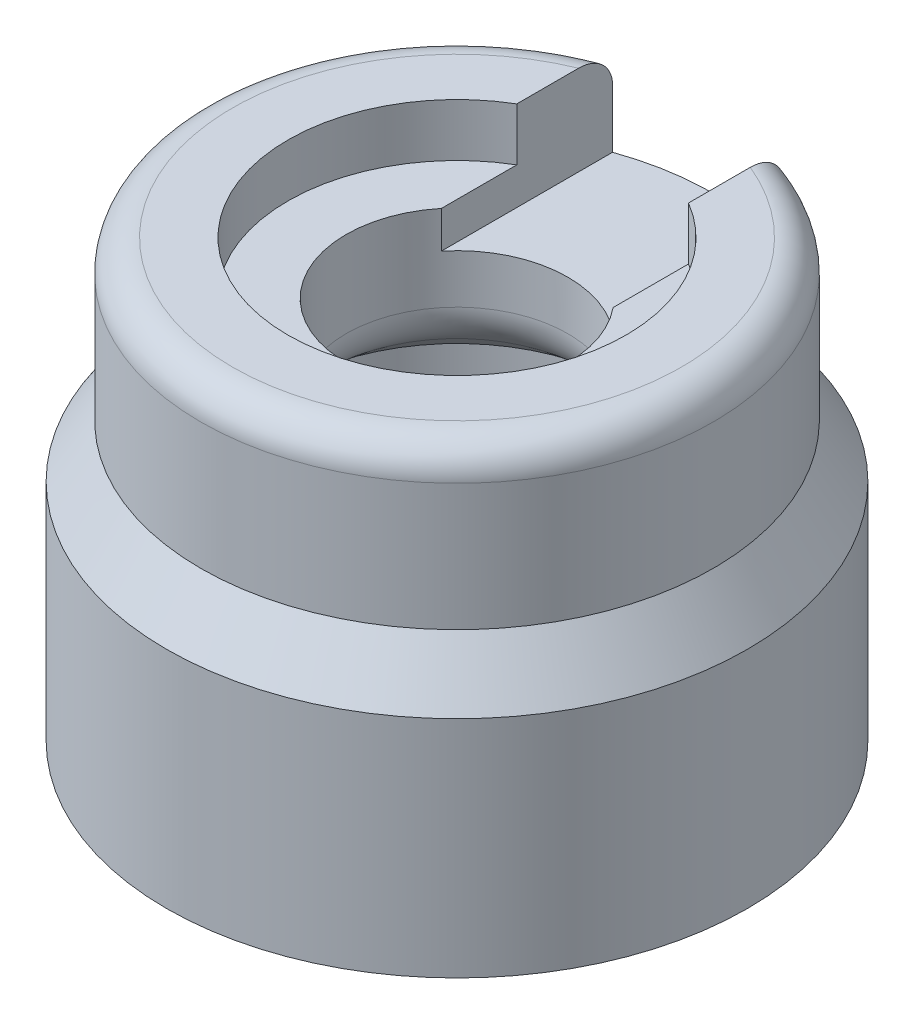
from build123d import *

# Parameters (mm, degrees)
CROQUIS1_R              = 5.5
CROQUIS1_R_2            = 3.2
SALIENTE_EXTRUIR1_DEPTH = 4.25
CROQUIS3_R              = 4.85
CROQUIS3_R_2            = 2.1
SALIENTE_EXTRUIR2_DEPTH = 3
REDONDEO1_R             = 0.6
CORTAR_EXTRUIR1_START   = -1
CROQUIS4_R              = 3.2
CORTAR_EXTRUIR1_DEPTH   = 1
CORTAR_EXTRUIR2_START   = -0.7
CROQUIS5_W              = 3.25
CROQUIS5_H              = 5
CORTAR_EXTRUIR2_DEPTH   = 12.333085159
REDONDEO2_R             = 1
REDONDEO3_R             = 0.75


with BuildPart() as part:
    # Croquis1 → Saliente-Extruir1 (new body)
    with BuildSketch(Plane(origin=(0, 0, 0), x_dir=(1, 0, 0), z_dir=(0, 1, 0))):
        Circle(CROQUIS1_R)
        Circle(CROQUIS1_R_2, mode=Mode.SUBTRACT)
    extrude(amount=SALIENTE_EXTRUIR1_DEPTH)

    # Croquis2 → Revolución1 (revolve)
    with BuildSketch(Plane.XY):
        Polygon((-5.5, 4.25), (-4.85, 5.25), (-2.1, 5.25), (-2.1, 5.15), (-3.2, 4.25), align=None)
    revolve(axis=Axis((0, 0, 0), (0, 1, 0)))

    # Croquis3 → Saliente-Extruir2 (add)
    with BuildSketch(Plane(origin=(0, 5.25, 0), x_dir=(1, 0, 0), z_dir=(0, 1, 0))):
        Circle(CROQUIS3_R)
        Circle(CROQUIS3_R_2, mode=Mode.SUBTRACT)
    extrude(amount=SALIENTE_EXTRUIR2_DEPTH)

    # Redondeo1
    redondeo1_edges = [part.edges().sort_by_distance(p)[0] for p in [
        (-4.85, 8.25, 0),
    ]]
    fillet(redondeo1_edges, radius=REDONDEO1_R)

    # Croquis4 → Cortar-Extruir1 (cut)
    with BuildSketch(Plane(origin=(0, 8.25, 0), x_dir=(1, 0, 0), z_dir=(0, 1, 0)).offset(CORTAR_EXTRUIR1_START)):
        Circle(CROQUIS4_R)
    extrude(amount=CORTAR_EXTRUIR1_DEPTH, mode=Mode.SUBTRACT)

    # Croquis5 → Cortar-Extruir2 (cut, through all)
    with BuildSketch(Plane(origin=(0, 7.25, 0), x_dir=(1, 0, 0), z_dir=(0, 1, 0)).offset(CORTAR_EXTRUIR2_START)):
        with Locations((0, 2.503070431)):
            Rectangle(CROQUIS5_W, CROQUIS5_H)
    extrude(amount=CORTAR_EXTRUIR2_DEPTH, mode=Mode.SUBTRACT)

    # Redondeo2
    redondeo2_edges = [part.edges().sort_by_distance(p)[0] for p in [
        (2.1, 5.15, 0),
    ]]
    fillet(redondeo2_edges, radius=REDONDEO2_R)

    # Redondeo3
    redondeo3_edges = [part.edges().sort_by_distance(p)[0] for p in [
        (-3.2, 0, 0),
    ]]
    fillet(redondeo3_edges, radius=REDONDEO3_R)


solid = part.part
